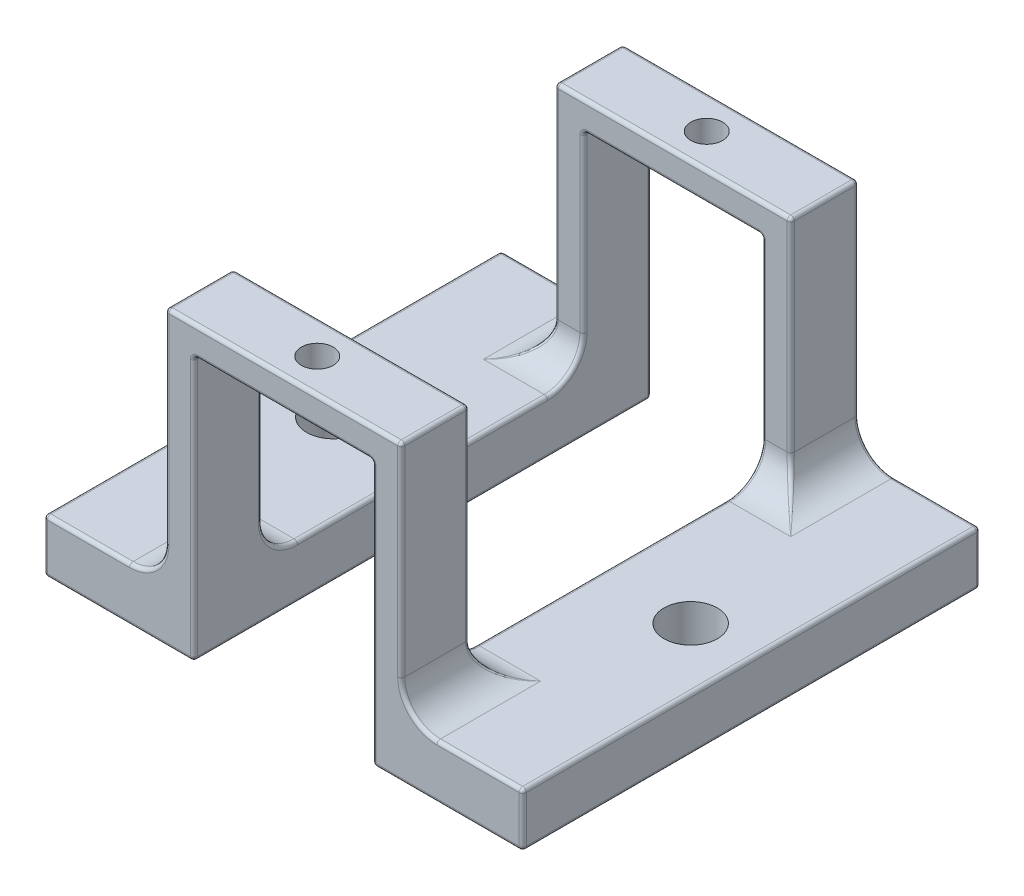
from build123d import *

# Parameters (mm, degrees)
BOSS_EXTRUDE1_DEPTH      = 4.826
BOSS_EXTRUDE1_DEPTH_BACK = 27.686
SKETCH2_W                = 22.86
SKETCH2_H                = 17.018
CUT_EXTRUDE1_DEPTH       = 43.959052364
FILLET4_R                = 2.54
FILLET5_R                = 0.254
F_10_24_TAPPED_HOLE1_D   = 3.7973
F_4_40_TAPPED_HOLE1_D    = 2.2606


with BuildPart() as part:
    # Sketch1 → Boss-Extrude1 (new, two sides: drawn at the far end of the back side and taken through both)
    with BuildSketch(Plane.XY.offset(-BOSS_EXTRUDE1_DEPTH_BACK)):
        Polygon((-17.018, 0), (-6.35, 0), (-6.35, 18.796), (6.35, 18.796), (6.35, 0), (17.018, 0), (17.018, 3.81), (8.382, 3.81), (8.382, 20.828), (-8.382, 20.828), (-8.382, 3.81), (-17.018, 3.81), align=None)
    extrude(amount=BOSS_EXTRUDE1_DEPTH + BOSS_EXTRUDE1_DEPTH_BACK)

    # Sketch2 → Cut-Extrude1 (cut, through all)
    with BuildSketch(Plane.ZY.offset(8.382)):
        with Locations((-11.43, 12.319)):
            Rectangle(SKETCH2_W, SKETCH2_H)
    extrude(amount=-CUT_EXTRUDE1_DEPTH, mode=Mode.SUBTRACT)

    # Fillet4
    fillet4_edges = [part.edges().sort_by_distance(p)[0] for p in [
        (8.382, 3.81, 2.413),
        (-8.382, 3.81, -25.273),
        (8.382, 3.81, -25.273),
        (7.366, 3.81, -22.86),
        (-7.366, 3.81, -22.86),
        (7.366, 3.81, 0),
        (-7.366, 3.81, 0),
        (-8.382, 3.81, 2.413),
    ]]
    fillet(fillet4_edges, radius=FILLET4_R)

    # Fillet5
    fillet5_edges = [part.edges().sort_by_distance(p)[0] for p in [
        (9.281035775, 4.411228117, -21.960964225),
        (9.281035775, 4.411228117, -0.899035775),
        (-9.281035775, 4.411228117, -0.899035775),
        (-9.281035775, 4.411228117, -21.960964225),
        (-17.018, 1.905, -27.686),
        (6.35, 9.398, -27.686),
        (11.684, 0, -27.686),
        (0, 20.828, -27.686),
        (-8.382, 13.589, -27.686),
        (8.382, 13.589, -27.686),
        (17.018, 1.905, -27.686),
        (0, 18.796, -27.686),
        (-6.35, 9.398, -27.686),
        (-11.684, 0, -27.686),
        (-8.382, 20.828, 2.413),
        (0, 20.828, 4.826),
        (8.382, 20.828, 2.413),
        (17.018, 3.81, -11.43),
        (17.018, 0, -11.43),
        (11.684, 0, 4.826),
        (6.35, 0, -11.43),
        (6.35, 9.398, 4.826),
        (6.35, 18.796, 2.413),
        (-6.35, 18.796, 2.413),
        (-11.684, 0, 4.826),
        (-6.35, 18.796, -25.273),
        (-6.35, 12.573, -22.86),
        (6.35, 18.796, -25.273),
        (-6.35, 0, -11.43),
        (8.382, 20.828, -25.273),
        (-17.018, 0, -11.43),
        (-8.382, 20.828, -25.273),
        (-6.35, 9.398, 4.826),
        (0, 20.828, -22.86),
        (8.382, 13.589, -22.86),
        (0, 18.796, -22.86),
        (-17.018, 1.905, 4.826),
        (6.35, 12.573, -22.86),
        (0, 20.828, 0),
        (0, 18.796, 0),
        (-17.018, 3.81, -11.43),
        (-13.97, 3.81, 4.826),
        (-8.382, 13.589, -22.86),
        (0, 18.796, 4.826),
        (17.018, 1.905, 4.826),
        (13.97, 3.81, -27.686),
        (6.35, 3.81, -11.43),
        (8.382, 13.589, 0),
        (8.382, 13.589, 4.826),
        (6.35, 12.573, 0),
        (-6.35, 12.573, 0),
        (-8.382, 13.589, 0),
        (13.97, 3.81, 4.826),
        (-6.35, 3.81, -11.43),
        (-13.97, 3.81, -27.686),
        (-8.382, 13.589, 4.826),
        (9.125948776, 4.553948776, -27.686),
        (9.125948776, 4.553948776, 4.826),
        (6.35, 4.553948776, -22.116051224),
        (6.35, 4.553948776, -0.743948776),
        (-6.35, 4.553948776, -0.743948776),
        (-9.125948776, 4.553948776, 4.826),
        (-6.35, 4.553948776, -22.116051224),
        (-9.125948776, 4.553948776, -27.686),
    ]]
    fillet(fillet5_edges, radius=FILLET5_R)

    # #10-24 Tapped Hole1 (through all)
    with Locations(Plane(origin=(0, 3.81, 0), x_dir=(1, 0, 0), z_dir=(0, 1, 0))):
        with Locations((-12.7, 11.43), (12.7, 11.43)):
            Hole(F_10_24_TAPPED_HOLE1_D / 2)

    # #4-40 Tapped Hole1 (through all)
    with Locations(Plane(origin=(0, 20.828, 0), x_dir=(1, 0, 0), z_dir=(0, 1, 0))):
        with Locations((0, 25.273), (0, -2.413)):
            Hole(F_4_40_TAPPED_HOLE1_D / 2)


solid = part.part
